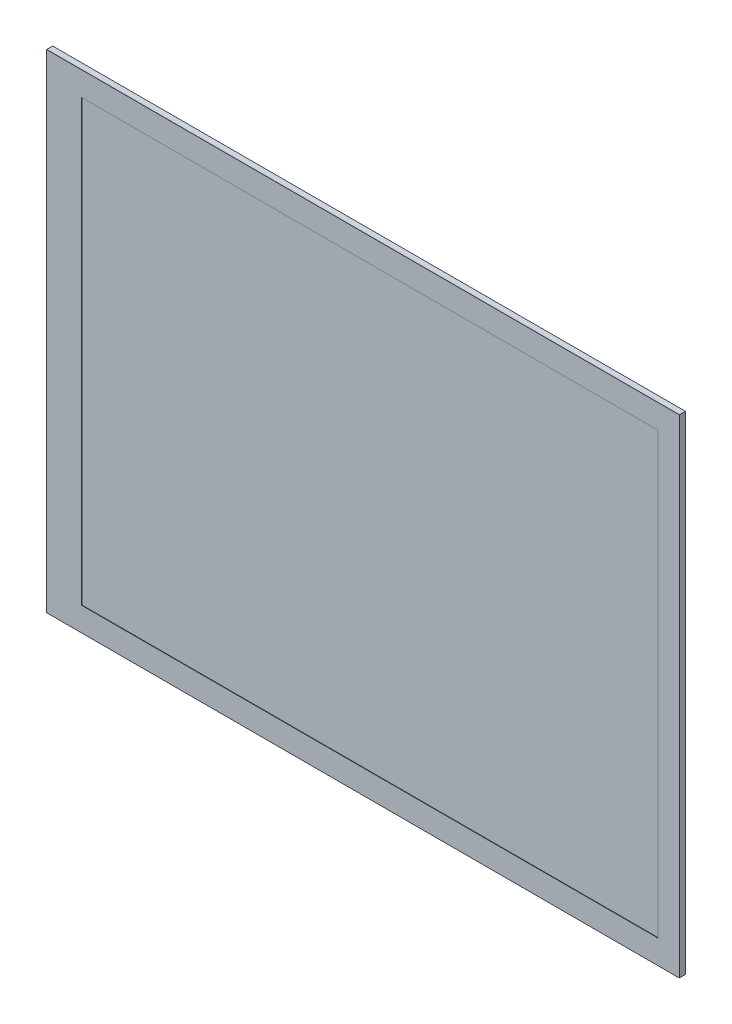
from build123d import *

# Parameters (mm, degrees)
SKETCH1_W             = 144
SKETCH1_H             = 111
BOSS_EXTRUDE1_DEPTH   = 1.3
BOSS_EXTRUDE2_DEPTH   = 0.1
SKETCH5_W             = 131.2
SKETCH5_H             = 100.1
BOSS_EXTRUDE3_DEPTH   = 0.1
BODY_MOVE_COPY1_ANGLE = 90


with BuildPart() as part:
    # Sketch1 → Boss-Extrude1 (new body)
    with BuildSketch(Plane.XY):
        with Locations((72, 55.5)):
            Rectangle(SKETCH1_W, SKETCH1_H)
    extrude(amount=BOSS_EXTRUDE1_DEPTH)

    # Sketch2 → Boss-Extrude2 (add)
    with BuildSketch(Plane.XY.offset(1.3)):
        with BuildLine():
            Line((0, 66.5), (-3, 66.5))
            ThreePointArc((-3, 66.5), (-3.707106781, 66.207106781), (-4, 65.5))
            Line((-4, 65.5), (-4, 59))
            ThreePointArc((-4, 59), (-4.292893219, 58.292893219), (-5, 58))
            Line((-5, 58), (-10, 58))
            Line((-10, 58), (-10, 53))
            Line((-10, 53), (-5, 53))
            ThreePointArc((-5, 53), (-4.292893219, 52.707106781), (-4, 52))
            Line((-4, 52), (-4, 45.5))
            ThreePointArc((-4, 45.5), (-3.707106781, 44.792893219), (-3, 44.5))
            Line((-3, 44.5), (0, 44.5))
            Line((0, 44.5), (0, 66.5))
        make_face()
    extrude(amount=-BOSS_EXTRUDE2_DEPTH)


with BuildPart() as body_2:
    # Sketch5 → Boss-Extrude3 (new body)
    with BuildSketch(Plane.XY.offset(1.3)):
        Polygon((144, 111), (0, 111), (0, 66.5), (0, 44.5), (0, 0), (144, 0), align=None)
        with Locations((73.6, 55.5)):
            Rectangle(SKETCH5_W, SKETCH5_H, mode=Mode.SUBTRACT)
    extrude(amount=BOSS_EXTRUDE3_DEPTH)


with BuildPart() as body_3:
    # Split1: the piece on the far side of the plane
    add(part.part)
    split(bisect_by=Plane(origin=(0, 0, 1.3), x_dir=(0, 0, 1), z_dir=(1, 0, 0)), keep=Keep.BOTTOM)


with BuildPart() as part_1:
    add(part.part)

    # Split1
    split(bisect_by=Plane(origin=(0, 0, 1.3), x_dir=(0, 0, 1), z_dir=(1, 0, 0)), keep=Keep.TOP)


with BuildPart() as body_3_1:
    # Body-Move/Copy1: moved
    add(body_3.part.rotate(Axis((0, 0, 1.4), (0, -1, 0)), BODY_MOVE_COPY1_ANGLE))


solid = Compound([body_2.part, part_1.part, body_3_1.part])
